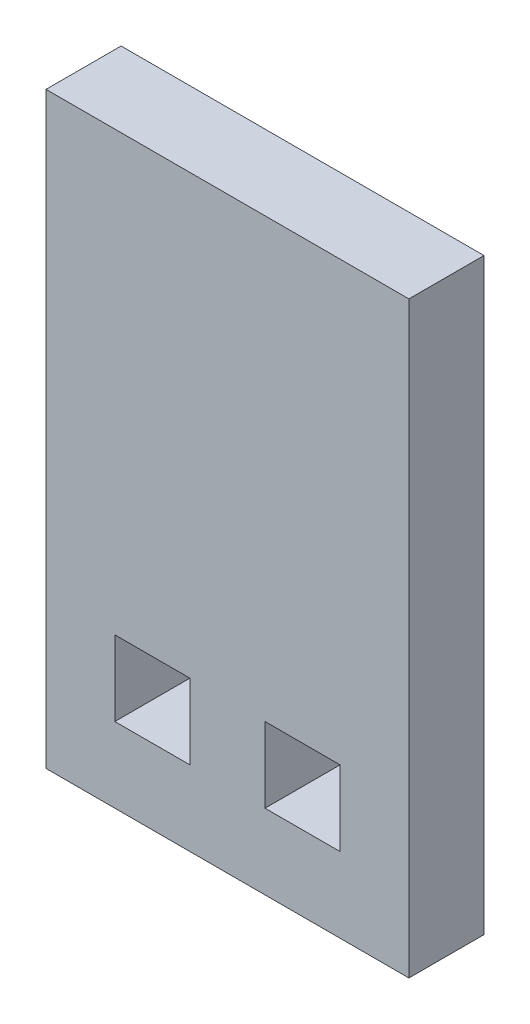
from build123d import *

# Parameters (mm, degrees)
SKETCH1_W           = 3
SKETCH1_H           = 3
BOSS_EXTRUDE1_DEPTH = 3


with BuildPart() as part:
    # Sketch1 → Boss-Extrude1 (new body)
    with BuildSketch(Plane.XY):
        Polygon((-3.861725009, -22.178574752), (-3.861725009, -1.678574752), (10.638274991, -1.678574752), (10.638274991, -22.178574752), (10.638274991, -25.178574752), (-3.861725009, -25.178574752), align=None)
        with Locations((0.388274991, -20.678574752)):
            Rectangle(SKETCH1_W, SKETCH1_H, mode=Mode.SUBTRACT)
        with Locations((6.388274991, -20.678574752)):
            Rectangle(SKETCH1_W, SKETCH1_H, mode=Mode.SUBTRACT)
    extrude(amount=BOSS_EXTRUDE1_DEPTH)


solid = part.part
